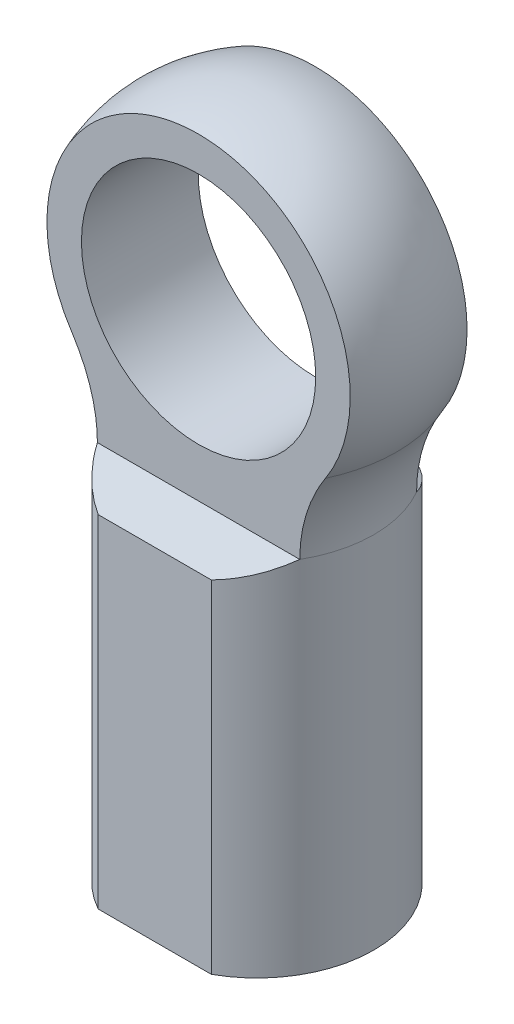
from build123d import *
from OCP.BRepAlgoAPI import BRepAlgoAPI_Cut
from OCP.TopTools import TopTools_ListOfShape

# Parameters (mm, degrees)
SKETCH1_W               = 8
SKETCH1_H               = 24.629121626
SKETCH12_W              = 4
SKETCH12_H              = 17
CUT_SWEEP1_PITCH        = 1.25
CUT_SWEEP1_FROM         = 0
SKETCH14_W              = 14
SKETCH14_H              = 1
CUT_EXTRUDE5_DEPTH      = 28.103387834
CUT_EXTRUDE1_DEPTH      = 34.985980566
CUT_EXTRUDE1_DEPTH_BACK = 34.985980566
CUT_EXTRUDE2_DEPTH      = 33.867632254
CUT_EXTRUDE2_DEPTH_BACK = 33.867632254
SKETCH6_R               = 8.0194


with BuildPart() as part:
    # Sketch1 → Revolve1 (revolve)
    with BuildSketch(Plane.XY, mode=Mode.PRIVATE) as revolve1_sk:
        with Locations((4, -4.685439187)):
            Rectangle(SKETCH1_W, SKETCH1_H)
    revolve(revolve1_sk.sketch.rotate(Axis((0, 30.125, 0), (0, -1, 0)), 180), axis=Axis((0, 30.125, 0), (0, -1, 0)))

    # Sketch14 → Cut-Extrude5 (cut, through all)
    with BuildSketch(Plane(origin=(0, -17, 0), x_dir=(-1, 0, 0), z_dir=(0, 1, 0))):
        with Locations((0, 7.5)):
            Rectangle(SKETCH14_W, SKETCH14_H)
        with Locations((0, -7.5)):
            Rectangle(SKETCH14_W, SKETCH14_H)
    extrude(amount=CUT_EXTRUDE5_DEPTH, mode=Mode.SUBTRACT)


with BuildPart() as body_2:
    # Sketch12 → Revolve4 (revolve)
    with BuildSketch(Plane.XY):
        with Locations((2, -8.5)):
            Rectangle(SKETCH12_W, SKETCH12_H)
    revolve(axis=Axis((0, 0, 0), (0, 1, 0)))

    # Cut-Sweep1: arcs per turn and ends read off the stored shape
    # Cut-Sweep1: the profile of Sketch16 profile screwed along a right-hand helix through 15.599997 turns, 8 arcs to a turn; built about Z, then put on its axis
    cut_sweep1_z = Axis((0, 0, 0), (0, 0, 1))
    cut_sweep1_corners = [(4.0003, 0, -2.343923205), (4.0003, 0, -1.249826795), (3.188101184, 0, -1.71875), (3.188101184, 0, -1.875)]
    with BuildLine(mode=Mode.PRIVATE) as cut_sweep1_profile:
        Line(cut_sweep1_corners[0], cut_sweep1_corners[1])
        Line(cut_sweep1_corners[1], cut_sweep1_corners[2])
        Line(cut_sweep1_corners[2], cut_sweep1_corners[3])
        Line(cut_sweep1_corners[3], cut_sweep1_corners[0])
    cut_sweep1_cap = Face(cut_sweep1_profile.wire())
    cut_sweep1_turn_angles = [0, 22.5, 45, 67.5, 90, 112.5, 135, 157.5, 180, 202.5, 225, 247.5, 270, 292.5, 315, 337.5, 360]
    cut_sweep1_turn_weights = [1, 0.9238795325112867, 1, 0.9238795325112867, 1, 0.9238795325112867, 1, 0.9238795325112867, 1, 0.9238795325112867, 1, 0.9238795325112867, 1, 0.9238795325112867, 1, 0.9238795325112867, 1]
    cut_sweep1_turn_rails = [Edge.make_bspline([Vector(p[0], p[1], 0).rotate(cut_sweep1_z, cut_sweep1_turn_angles[k]) / cut_sweep1_turn_weights[k] + Vector(0, 0, p[2] + CUT_SWEEP1_PITCH * cut_sweep1_turn_angles[k] / 360) for k in range(17)], [0, 0, 0, 1, 1, 2, 2, 3, 3, 4, 4, 5, 5, 6, 6, 7, 7, 8, 8, 8], 2, cut_sweep1_turn_weights) for p in cut_sweep1_corners]
    cut_sweep1_turn_sides = [Face.make_surface_from_curves(cut_sweep1_turn_rails[p[0]], cut_sweep1_turn_rails[p[1]]) for p in [(0, 1), (1, 2), (2, 3), (3, 0)]]
    cut_sweep1_last_angles = [5400, 5422.5, 5445, 5467.5, 5490, 5512.5, 5535, 5557.5, 5580, 5597.9995, 5615.999]
    cut_sweep1_last_weights = [1, 0.9238795325112867, 1, 0.9238795325112867, 1, 0.9238795325112867, 1, 0.9238795325112867, 1, 0.9510592129409388, 1]
    cut_sweep1_last_rails = [Edge.make_bspline([Vector(p[0], p[1], 0).rotate(cut_sweep1_z, cut_sweep1_last_angles[k]) / cut_sweep1_last_weights[k] + Vector(0, 0, p[2] + CUT_SWEEP1_PITCH * cut_sweep1_last_angles[k] / 360) for k in range(11)], [0, 0, 0, 1, 1, 2, 2, 3, 3, 4, 4, 5, 5, 5], 2, cut_sweep1_last_weights) for p in cut_sweep1_corners]
    cut_sweep1_last_sides = [Face.make_surface_from_curves(cut_sweep1_last_rails[p[0]], cut_sweep1_last_rails[p[1]]) for p in [(0, 1), (1, 2), (2, 3), (3, 0)]]
    cut_sweep1 = Plane(origin=(0, 0, 0), x_dir=(0, 0, 1), z_dir=(0, -1, 0)) * split(Solid(Shell([*[p.moved(Location((0, 0, CUT_SWEEP1_PITCH * i))) for i in range(15) for p in cut_sweep1_turn_sides], *cut_sweep1_last_sides, cut_sweep1_cap, cut_sweep1_cap.rotate(cut_sweep1_z, 5615.999).moved(Location((0, 0, CUT_SWEEP1_PITCH * 5615.999 / 360)))])), bisect_by=Plane.XY.offset(CUT_SWEEP1_FROM), keep=Keep.TOP, mode=Mode.PRIVATE)
    add(cut_sweep1, mode=Mode.SUBTRACT)


with BuildPart() as part_1:
    add(part.part)

    # Combine1: cut body 2
    add(body_2.part, mode=Mode.SUBTRACT)

    # Extrude1 cone 1 section (through the dimple's axis) → Extrude1 (revolve, cut)
    with BuildSketch(Plane(origin=(0, -17, 0), x_dir=(0, 0, -1), z_dir=(1, 0, 0))):
        Polygon((0, 0), (4.025, 0), (0, 4.025), align=None)
    revolve(axis=Axis((0, -17, 0), (0, 1, 0)), mode=Mode.SUBTRACT)

    # Sketch4 → Revolve2 (revolve)
    with BuildSketch(Plane.XY):
        with BuildLine():
            Line((8, 7.629121626), (0, 7.629121626))
            Line((0, 7.629121626), (0, 30.125))
            ThreePointArc((0, 30.125), (9.669956979, 24.500686959), (9.5625, 13.314560813))
            ThreePointArc((9.5625, 13.314560813), (8.397734796, 10.57724073), (8, 7.629121626))
        make_face()
    revolve(axis=Axis((0, 30.125, 0), (0, 1, 0)))


with BuildPart() as cut_extrude1_tool:
    # Sketch5 → Cut-Extrude1 (new, two sides: drawn at the far end of the back side and taken through both)
    with BuildSketch(Plane(origin=(0, 0, 0), x_dir=(0, 0, -1), z_dir=(1, 0, 0)).offset(-CUT_EXTRUDE1_DEPTH_BACK)):
        Polygon((4, 30.125), (11.125, 30.125), (11.125, 7.629121626), (11.125, 4.677849994), (4, 7.629121626), align=None)
        Polygon((-4, 30.125), (-4, 7.629121626), (-11.125, 4.677849994), (-11.125, 7.629121626), (-11.125, 30.125), align=None)
    extrude(amount=CUT_EXTRUDE1_DEPTH + CUT_EXTRUDE1_DEPTH_BACK)


with BuildPart() as part_2:
    add(part_1.part)

    # Cut-Extrude1: cut by cut_extrude1_tool, with a tolerance
    cut_extrude1_stock = TopTools_ListOfShape()
    cut_extrude1_stock.Append(part_2.part.wrapped)
    cut_extrude1_tools = TopTools_ListOfShape()
    cut_extrude1_tools.Append(cut_extrude1_tool.part.wrapped)
    cut_extrude1_cut = BRepAlgoAPI_Cut()
    cut_extrude1_cut.SetArguments(cut_extrude1_stock)
    cut_extrude1_cut.SetTools(cut_extrude1_tools)
    cut_extrude1_cut.SetFuzzyValue(0.00001)
    cut_extrude1_cut.Build()
    add(Compound.cast(cut_extrude1_cut.Shape()).solids(), mode=Mode.REPLACE)

    # Sketch6 → Cut-Extrude2 (cut, two sides: drawn at the far end of the back side and taken through both)
    with BuildSketch(Plane.XY.offset(-CUT_EXTRUDE2_DEPTH_BACK)):
        with Locations(Location((0, 19, 0), (0, 0, 270))):
            Circle(SKETCH6_R)
    extrude(amount=CUT_EXTRUDE2_DEPTH + CUT_EXTRUDE2_DEPTH_BACK, mode=Mode.SUBTRACT)


solid = part_2.part
